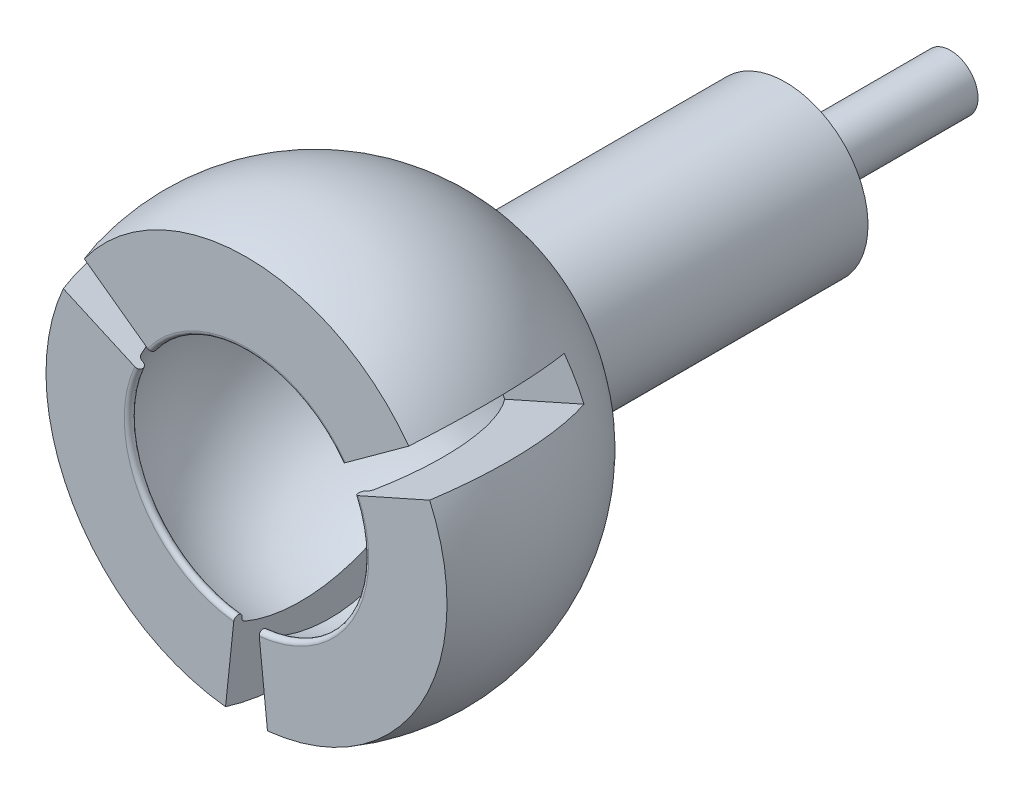
from build123d import *

# Parameters (mm, degrees)
CORTAR_REVOLUCI_N1_START = 13.6
CORTAR_REVOLUCI_N1_DEPTH = 6
MATRIZC1_COUNT           = 3
CROQUIS4_R               = 0.75
CORTAR_EXTRUIR1_DEPTH    = 28.824090282


# Read off the part's stored shape, not the designer's step: Cortar-Revolución1
with BuildPart() as part:
    # Croquis1 → Revolución1 (revolve)
    with BuildSketch(Plane.YZ):
        with BuildLine():
            Line((-3, 0), (-3, 10))
            ThreePointArc((-3, 10), (-7.036805787, 13.954628111), (-7.291090453, 19.6))
            Line((-7.291090453, 19.6), (-4.445222154, 19.6))
            ThreePointArc((-4.445222154, 19.6), (-4.295338521, 19.444092675), (-4.45702764, 19.300465287))
            ThreePointArc((-4.45702764, 19.300465287), (-4.57485069, 19.273071665), (-4.655330258, 19.182762635))
            ThreePointArc((-4.655330258, 19.182762635), (-4.279724841, 14.326202011), (0, 12))
            Line((0, 12), (0, 0))
            Line((0, 0), (0, -6))
            Line((0, -6), (-1, -6))
            Line((-1, -6), (-1, 0))
            Line((-1, 0), (-3, 0))
        make_face()
    revolve(axis=Axis((0, 0, 0), (0, 0, -1)))

    # Cortar-Revolución1 outline → Cortar-Revolución1 (cut)
    with BuildSketch(Plane.XY.offset(CORTAR_REVOLUCI_N1_START)):
        Polygon((0.945938118, -9), (0.805683263, -7.665564198), (0.387742836, -3.689126657), (0.21020847, -2), (-0.21020847, -2), (-0.387742836, -3.689126657), (-0.805683263, -7.665564198), (-0.945938118, -9), align=None)
    cortar_revoluci_n1 = extrude(amount=CORTAR_REVOLUCI_N1_DEPTH, mode=Mode.SUBTRACT)

    # MatrizC1: Cortar-Revolución1 ×3 about axis
    matrizc1_axis = Axis((0, 0, 0), (0, 0, 1))
    for i in range(1, MATRIZC1_COUNT):
        add(cortar_revoluci_n1.rotate(matrizc1_axis, i * 360 / MATRIZC1_COUNT), mode=Mode.SUBTRACT)

    # Croquis4 → Cortar-Extruir1 (cut, through all)
    with BuildSketch(Plane.XY.offset(19.6)):
        Circle(CROQUIS4_R)
    extrude(amount=-CORTAR_EXTRUIR1_DEPTH, mode=Mode.SUBTRACT)


solid = part.part
